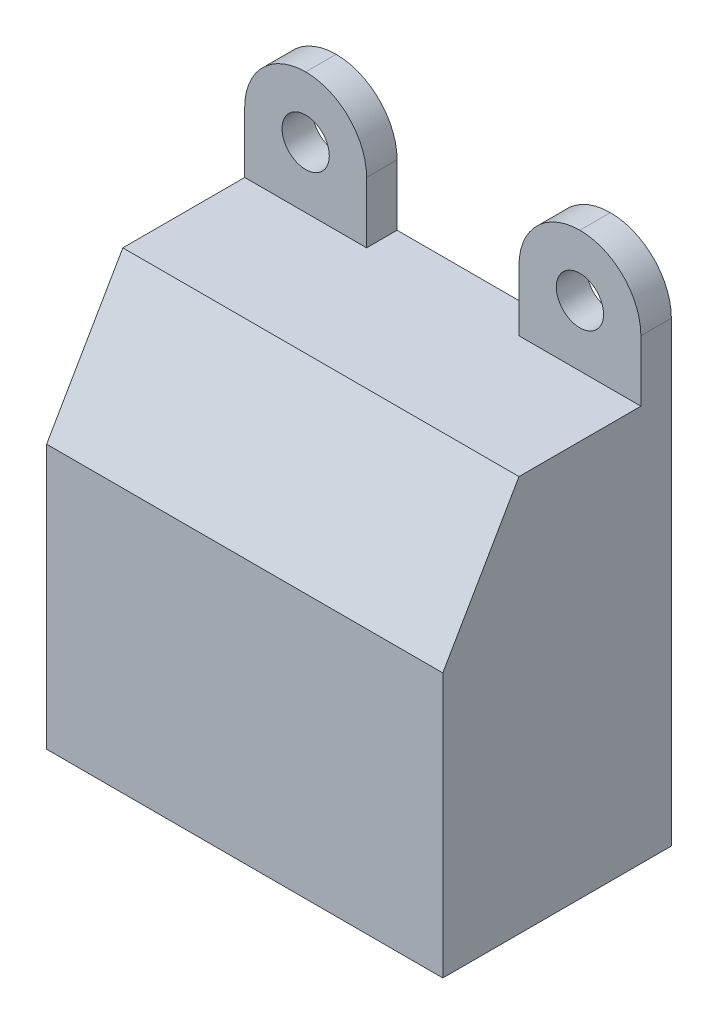
from build123d import *

# Parameters (mm, degrees)
SKETCH1_W           = 26
SKETCH1_H           = 26
BOSS_EXTRUDE1_DEPTH = 15
CHAMFER1_SIZE       = 5
CHAMFER1_SIZE2      = 8.660254038
SKETCH2_W           = 8
SKETCH2_H           = 2
BOSS_EXTRUDE2_DEPTH = 8
FILLET1_R           = 4
CUT_EXTRUDE2_REACH  = 80.899
SKETCH5_R           = 1.55


with BuildPart() as part:
    # Sketch1 → Boss-Extrude1 (new body)
    with BuildSketch(Plane.XY):
        with Locations((57, 13)):
            Rectangle(SKETCH1_W, SKETCH1_H)
    extrude(amount=BOSS_EXTRUDE1_DEPTH)

    # Chamfer1
    chamfer1_edges = [part.edges().sort_by_distance(p)[0] for p in [
        (57, 26, 15),
    ]]
    chamfer1_side = [part.faces().sort_by_distance(p)[0] for p in [
        (57, 26, 7.5),
    ]]
    chamfer(chamfer1_edges, length=CHAMFER1_SIZE, length2=CHAMFER1_SIZE2, reference=chamfer1_side[0])

    # Sketch2 → Boss-Extrude2 (add)
    with BuildSketch(Plane(origin=(0, 26, 0), x_dir=(1, 0, 0), z_dir=(0, 1, 0))):
        with Locations((48, -1)):
            Rectangle(SKETCH2_W, SKETCH2_H)
        with Locations((66, -1)):
            Rectangle(SKETCH2_W, SKETCH2_H)
    extrude(amount=BOSS_EXTRUDE2_DEPTH)

    # Fillet1
    fillet1_edges = [part.edges().sort_by_distance(p)[0] for p in [
        (44, 34, 1),
        (52, 34, 1),
        (62, 34, 1),
        (70, 34, 1),
    ]]
    fillet(fillet1_edges, radius=FILLET1_R - 0.0001)  # a hair under: the kernel refuses the full size

    # Sketch5 → Cut-Extrude2 (cut, up to next)
    with BuildSketch(Plane.XY.offset(2), mode=Mode.PRIVATE) as cut_extrude2_sk1:
        with Locations((66, 30)):
            Circle(SKETCH5_R)
    cut_extrude2_tool1 = extrude(cut_extrude2_sk1.sketch, amount=-CUT_EXTRUDE2_REACH, mode=Mode.PRIVATE) & part.part
    # Sketch5 → Cut-Extrude2 (cut, up to next)
    with BuildSketch(Plane.XY.offset(2), mode=Mode.PRIVATE) as cut_extrude2_sk2:
        with Locations((48, 30)):
            Circle(SKETCH5_R)
    cut_extrude2_tool2 = extrude(cut_extrude2_sk2.sketch, amount=-CUT_EXTRUDE2_REACH, mode=Mode.PRIVATE) & part.part
    add(cut_extrude2_tool1.solids().sort_by_distance((66, 30, 2))[0], mode=Mode.SUBTRACT)
    add(cut_extrude2_tool2.solids().sort_by_distance((48, 30, 2))[0], mode=Mode.SUBTRACT)


solid = part.part
